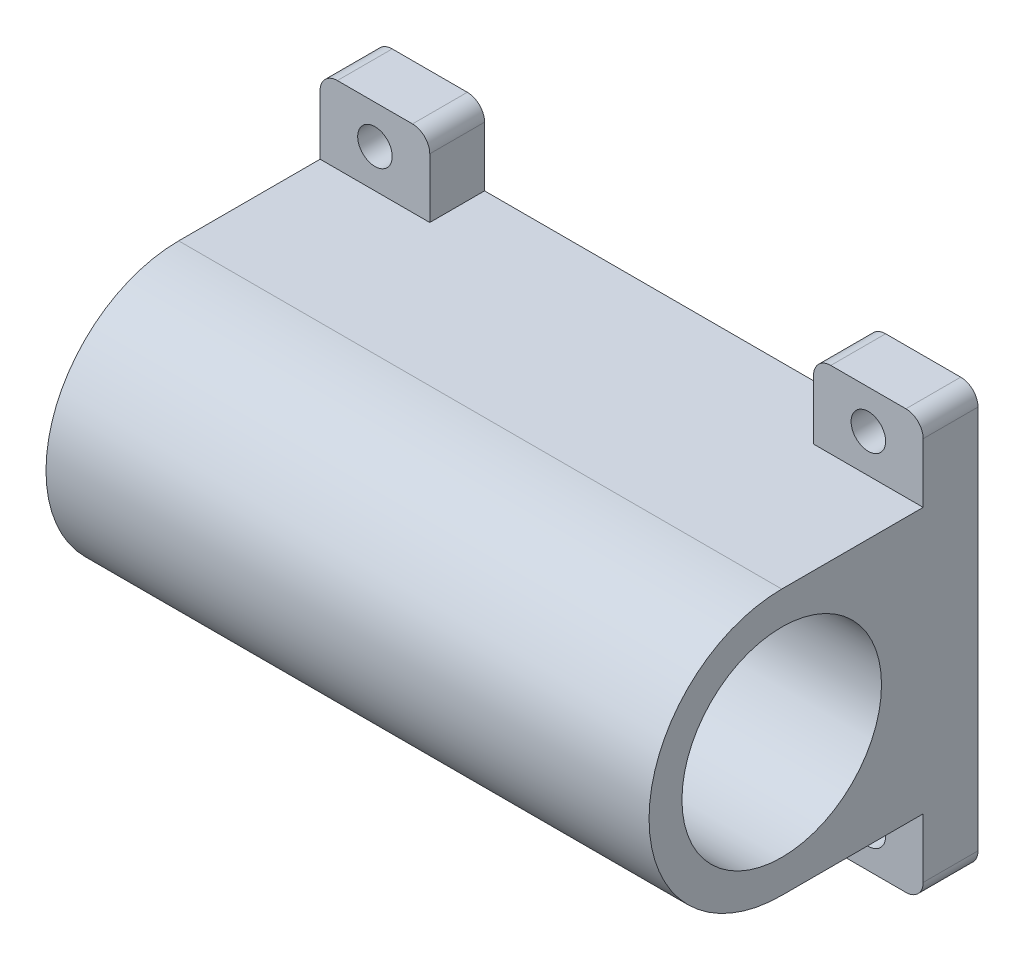
from build123d import *

# Parameters (mm, degrees)
SKETCH1_W               = 69.85
SKETCH1_H               = 30.734
BOSS_EXTRUDE1_DEPTH     = 38.1
SKETCH2_R               = 11.557
CUT_EXTRUDE1_DEPTH      = 82.035653814
SKETCH5_W               = 12.7
SKETCH5_H               = 8.89
SKETCH5_R               = 2
BOSS_EXTRUDE2_DEPTH     = 6.35
MIRROR2_COPY_1_SKETCH_W = 12.7
MIRROR2_COPY_1_SKETCH_H = 8.89
MIRROR2_COPY_1_SKETCH_R = 2
MIRROR2_COPY_1_DEPTH    = 6.35
MIRROR2_COPY_2_SKETCH_W = 12.7
MIRROR2_COPY_2_SKETCH_H = 8.89
MIRROR2_COPY_2_SKETCH_R = 2
MIRROR2_COPY_2_DEPTH    = 6.35
FILLET1_R               = 2


with BuildPart() as part:
    # Sketch1 → Boss-Extrude1 (new body)
    with BuildSketch(Plane.XY):
        Rectangle(SKETCH1_W, SKETCH1_H)
    extrude(amount=BOSS_EXTRUDE1_DEPTH)

    # Sketch2 → Cut-Extrude1 (cut, through all)
    with BuildSketch(Plane(origin=(34.925, 0, 0), x_dir=(0, 0, -1), z_dir=(1, 0, 0))):
        with BuildLine():
            ThreePointArc((-22.733, -15.367), (-33.599109906, -10.866109906), (-38.1, 0))
            Line((-38.1, 0), (-38.1, -15.367))
            Line((-38.1, -15.367), (-22.733, -15.367))
        make_face()
        with BuildLine():
            Line((-38.1, 15.367), (-38.1, 0))
            ThreePointArc((-38.1, 0), (-33.599109906, 10.866109906), (-22.733, 15.367))
            Line((-22.733, 15.367), (-38.1, 15.367))
        make_face()
        with Locations((-22.733, 0)):
            Circle(SKETCH2_R)
    extrude(amount=-CUT_EXTRUDE1_DEPTH, mode=Mode.SUBTRACT)

    # Sketch5 → Boss-Extrude2 (add)
    with BuildSketch(Plane(origin=(0, 0, 0), x_dir=(-1, 0, 0), z_dir=(0, 0, -1))):
        with Locations((-28.575, 19.812)):
            Rectangle(SKETCH5_W, SKETCH5_H)
        with Locations((-28.575, 19.812)):
            Circle(SKETCH5_R, mode=Mode.SUBTRACT)
    boss_extrude2 = extrude(amount=-BOSS_EXTRUDE2_DEPTH)

    # Mirror1: Boss-Extrude2 across plane
    add(boss_extrude2.mirror(Plane.ZX))

    # Mirror2 copy 1 sketch → Mirror2 copy 1 (add)
    with BuildSketch(Plane(origin=(0, 0, 0), x_dir=(1, 0, 0), z_dir=(0, 0, -1))):
        with Locations((-28.575, 19.812)):
            Rectangle(MIRROR2_COPY_1_SKETCH_W, MIRROR2_COPY_1_SKETCH_H)
        with Locations((-28.575, 19.812)):
            Circle(MIRROR2_COPY_1_SKETCH_R, mode=Mode.SUBTRACT)
    extrude(amount=-MIRROR2_COPY_1_DEPTH)

    # Mirror2 copy 2 sketch → Mirror2 copy 2 (add)
    with BuildSketch(Plane(origin=(0, 0, 0), x_dir=(1, 0, 0), z_dir=(0, 0, -1))):
        with Locations((-28.575, -19.812)):
            Rectangle(MIRROR2_COPY_2_SKETCH_W, MIRROR2_COPY_2_SKETCH_H)
        with Locations((-28.575, -19.812)):
            Circle(MIRROR2_COPY_2_SKETCH_R, mode=Mode.SUBTRACT)
    extrude(amount=-MIRROR2_COPY_2_DEPTH)

    # Fillet1
    fillet1_edges = [part.edges().sort_by_distance(p)[0] for p in [
        (34.925, -24.257, 3.175),
        (22.225, -24.257, 3.175),
        (-22.225, -24.257, 3.175),
        (-34.925, -24.257, 3.175),
        (-34.925, 24.257, 3.175),
        (-22.225, 24.257, 3.175),
        (34.925, 24.257, 3.175),
        (22.225, 24.257, 3.175),
    ]]
    fillet(fillet1_edges, radius=FILLET1_R)


solid = part.part
